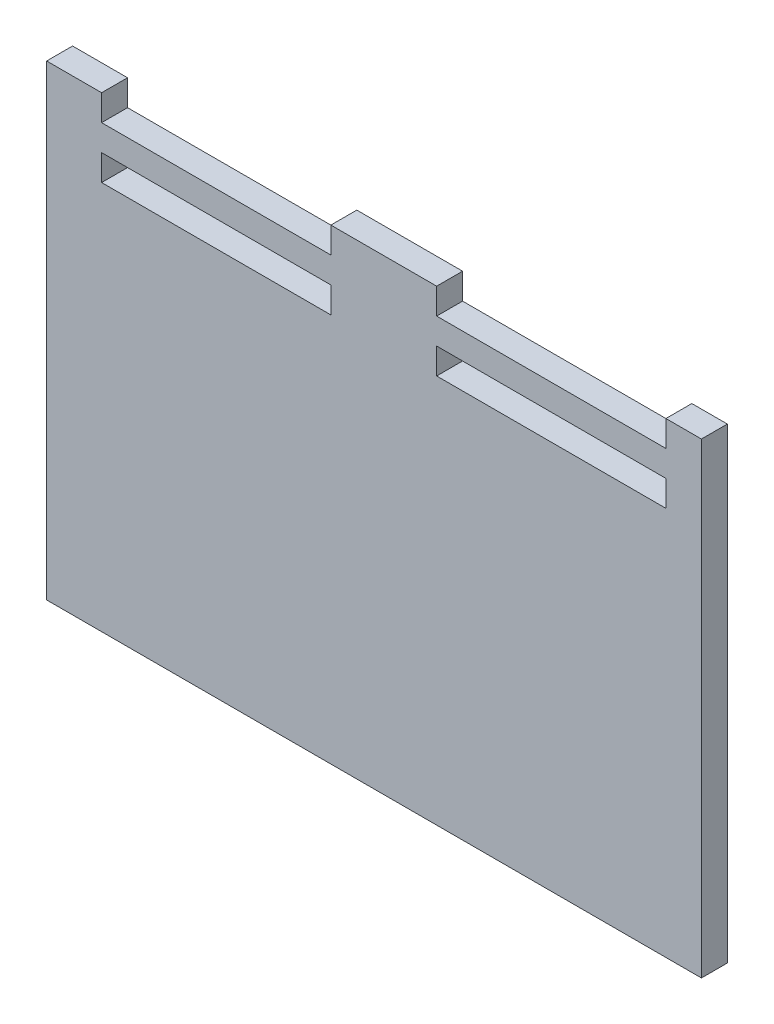
from build123d import *

# Parameters (mm, degrees)
SKETCH1_W           = 304.8
SKETCH1_H           = 228.6
BOSS_EXTRUDE1_DEPTH = 12.7
SKETCH7_W           = 112.268
SKETCH7_H           = 12.7
CUT_EXTRUDE2_DEPTH  = 12.7
SKETCH8_W           = 3.175
SKETCH8_H           = 228.6
SKETCH8_W_2         = 12.7
BOSS_EXTRUDE2_DEPTH = 12.7


with BuildPart() as part:
    # Sketch1 → Boss-Extrude1 (new body)
    with BuildSketch(Plane.XY):
        with Locations((152.4, 114.3)):
            Rectangle(SKETCH1_W, SKETCH1_H)
    extrude(amount=BOSS_EXTRUDE1_DEPTH)

    # Sketch7 → Cut-Extrude2 (cut)
    with BuildSketch(Plane.XY.offset(12.7)):
        with Locations((70.358, 222.25)):
            Rectangle(SKETCH7_W, SKETCH7_H)
        with Locations((234.442, 222.25)):
            Rectangle(SKETCH7_W, SKETCH7_H)
        with Locations((70.358, 196.85)):
            Rectangle(SKETCH7_W, SKETCH7_H)
        with Locations((234.442, 196.85)):
            Rectangle(SKETCH7_W, SKETCH7_H)
    extrude(amount=-CUT_EXTRUDE2_DEPTH, mode=Mode.SUBTRACT)

    # Sketch8 → Boss-Extrude2 (add)
    with BuildSketch(Plane.XY.offset(12.7)):
        with Locations((306.3875, 114.3)):
            Rectangle(SKETCH8_W, SKETCH8_H)
        with Locations((-6.35, 114.3)):
            Rectangle(SKETCH8_W_2, SKETCH8_H)
    extrude(amount=-BOSS_EXTRUDE2_DEPTH)


solid = part.part
